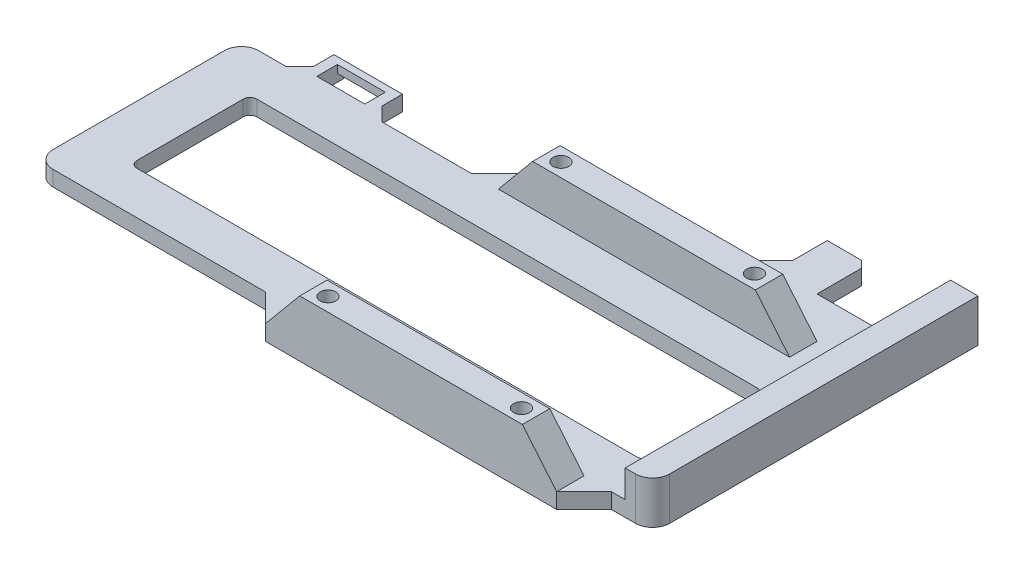
from build123d import *
from OCP.BRepFilletAPI import BRepFilletAPI_MakeChamfer

# Parameters (mm, degrees)
SKETCH1_W                       = 180
SKETCH1_H                       = 60
SKETCH1_W_2                     = 150
SKETCH1_H_2                     = 35
BOSS_EXTRUDE1_DEPTH             = 4.5
FILLET1_R                       = 5
FILLET2_R                       = 2
BOSS_EXTRUDE2_DEPTH             = 4.5
CHAMFER1_SIZE                   = 25
CHAMFER2_SIZE                   = 2
BOSS_EXTRUDE3_DEPTH             = 12
BOSS_EXTRUDE3_DIRECTION_2_REACH = 205.581
CHAMFER3_SIZE                   = 10
CHAMFER3_SIZE_2                 = 12
CHAMFER4_SIZE                   = 8
BOSS_EXTRUDE4_START             = 8
BOSS_EXTRUDE4_DEPTH             = 8
SKETCH5_R                       = 2.3
CUT_EXTRUDE1_DEPTH              = 14
CHAMFER5_SIZE                   = 12
CHAMFER5_SIZE2                  = 10
SKETCH6_W                       = 20
SKETCH6_H                       = 10
SKETCH6_W_2                     = 14
SKETCH6_H_2                     = 6
BOSS_EXTRUDE5_DEPTH             = 4.5
CHAMFER6_SIZE                   = 4
SKETCH7_W                       = 14
SKETCH7_H                       = 2.25
CUT_EXTRUDE2_DEPTH              = 3


with BuildPart() as part:
    # Sketch1 → Boss-Extrude1 (new body)
    with BuildSketch(Plane(origin=(0, 0, 0), x_dir=(1, 0, 0), z_dir=(0, 1, 0))):
        with Locations((90, 30)):
            Rectangle(SKETCH1_W, SKETCH1_H)
        with Locations((90, 30)):
            Rectangle(SKETCH1_W_2, SKETCH1_H_2, mode=Mode.SUBTRACT)
    extrude(amount=BOSS_EXTRUDE1_DEPTH)

    # Fillet1
    fillet1_edges = [part.edges().sort_by_distance(p)[0] for p in [
        (0, 2.25, -60),
        (180, 2.25, 0),
        (0, 2.25, 0),
    ]]
    fillet(fillet1_edges, radius=FILLET1_R)

    # Fillet2
    fillet2_edges = [part.edges().sort_by_distance(p)[0] for p in [
        (165, 2.25, -12.5),
        (165, 2.25, -47.5),
        (15, 2.25, -47.5),
        (15, 2.25, -12.5),
    ]]
    fillet(fillet2_edges, radius=FILLET2_R)

    # Sketch2 → Boss-Extrude2 (add)
    with BuildSketch(Plane(origin=(0, 4.5, 0), x_dir=(1, 0, 0), z_dir=(0, 1, 0))):
        Polygon((180, 80), (180, 60), (136, 60), (136, 80), (136, 95), (148, 95), (148, 80), (168, 80), (168, 95), (180, 95), align=None)
    extrude(amount=-BOSS_EXTRUDE2_DEPTH)

    # Chamfer1
    chamfer1_edges = [part.edges().sort_by_distance(p)[0] for p in [
        (136, 2.25, -60),
    ]]
    chamfer(chamfer1_edges, length=CHAMFER1_SIZE)

    # Chamfer2
    chamfer2_edges = [part.edges().sort_by_distance(p)[0] for p in [
        (168, 2.25, -95),
        (148, 2.25, -95),
    ]]
    chamfer(chamfer2_edges, length=CHAMFER2_SIZE)

    # Sketch3 → Boss-Extrude3 (add)
    with BuildSketch(Plane(origin=(0, 4.5, 0), x_dir=(1, 0, 0), z_dir=(0, 1, 0))):
        Polygon((90, -8), (160, -8), (160, 0), (90, 0), (75, 0), (75, -8), align=None)
        Polygon((160, 60), (90, 60), (75, 60), (75, 68), (90, 68), (160, 68), align=None)
    extrude(amount=BOSS_EXTRUDE3_DEPTH)

    # Boss-Extrude3 direction 2: up to this face of the body (flat: up to its plane)
    boss_extrude3_direction_2_end = Plane(part.part.faces().sort_by_distance((141, 0, -92.964686756))[0])
    # Sketch3 → Boss-Extrude3 direction 2 (add, up to the picked face)
    with BuildSketch(Plane(origin=(0, 4.5, 0), x_dir=(1, 0, 0), z_dir=(0, 1, 0)), mode=Mode.PRIVATE) as boss_extrude3_direction_2_sk1:
        Polygon((90, -8), (160, -8), (160, 0), (90, 0), (75, 0), (75, -8), align=None)
    boss_extrude3_direction_2_tool1 = split(extrude(boss_extrude3_direction_2_sk1.sketch, amount=-BOSS_EXTRUDE3_DIRECTION_2_REACH, mode=Mode.PRIVATE), bisect_by=boss_extrude3_direction_2_end, keep=Keep.BOTH, mode=Mode.PRIVATE)
    # Sketch3 → Boss-Extrude3 direction 2 (add, up to the picked face)
    with BuildSketch(Plane(origin=(0, 4.5, 0), x_dir=(1, 0, 0), z_dir=(0, 1, 0)), mode=Mode.PRIVATE) as boss_extrude3_direction_2_sk2:
        Polygon((160, 60), (90, 60), (75, 60), (75, 68), (90, 68), (160, 68), align=None)
    boss_extrude3_direction_2_tool2 = split(extrude(boss_extrude3_direction_2_sk2.sketch, amount=-BOSS_EXTRUDE3_DIRECTION_2_REACH, mode=Mode.PRIVATE), bisect_by=boss_extrude3_direction_2_end, keep=Keep.BOTH, mode=Mode.PRIVATE)
    add(boss_extrude3_direction_2_tool1.solids().sort_by(Axis((117.5, 4.5, 4), (0, -1, 0)))[0])
    add(boss_extrude3_direction_2_tool2.solids().sort_by(Axis((117.5, 4.5, -64), (0, -1, 0)))[0])

    # Chamfer3
    chamfer3_edges_1 = [part.edges().sort_by_distance(p)[0] for p in [
        (160, 16.5, -64),
    ]]
    chamfer3_side_1 = [part.faces().sort_by_distance(p)[0] for p in [
        (159.8, 16.5, -64),
    ]]
    chamfer3_edges_2 = [part.edges().sort_by_distance(p)[0] for p in [
        (75, 16.5, -64),
    ]]
    chamfer3_side_2 = [part.faces().sort_by_distance(p)[0] for p in [
        (75.2, 16.5, -64),
    ]]
    chamfer3_edges_3 = [part.edges().sort_by_distance(p)[0] for p in [
        (75, 16.5, 4),
    ]]
    chamfer3_side_3 = [part.faces().sort_by_distance(p)[0] for p in [
        (75.2, 16.5, 4),
    ]]
    chamfer3 = BRepFilletAPI_MakeChamfer(part.part.solid().wrapped)
    for e in chamfer3_edges_1:
        chamfer3.Add(CHAMFER3_SIZE - 0.0001, CHAMFER3_SIZE_2 - 0.0001, e.wrapped, chamfer3_side_1[0].wrapped)
    for e in chamfer3_edges_2:
        chamfer3.Add(CHAMFER3_SIZE - 0.0001, CHAMFER3_SIZE_2 - 0.0001, e.wrapped, chamfer3_side_2[0].wrapped)
    for e in chamfer3_edges_3:
        chamfer3.Add(CHAMFER3_SIZE - 0.0001, CHAMFER3_SIZE_2 - 0.0001, e.wrapped, chamfer3_side_3[0].wrapped)
    add(Compound.cast(chamfer3.Shape()), mode=Mode.REPLACE)  # a hair under: the kernel refuses the full size

    # Chamfer4
    chamfer4_edges = [part.edges().sort_by_distance(p)[0] for p in [
        (160, 2.25, 0),
        (75, 2.25, 0),
        (75, 2.25, -60),
    ]]
    chamfer(chamfer4_edges, length=CHAMFER4_SIZE - 0.0001)  # a hair under: the kernel refuses the full size

    # Sketch4 → Boss-Extrude4 (add)
    with BuildSketch(Plane(origin=(0, 4.5, 0), x_dir=(1, 0, 0), z_dir=(0, 1, 0)).offset(BOSS_EXTRUDE4_START)):
        with BuildLine():
            Line((180, 95), (180, 5))
            ThreePointArc((180, 5), (178.535533906, 1.464466094), (175, 0))
            Line((175, 0), (172, 0))
            Line((172, 0), (172, 95))
            Line((172, 95), (180, 95))
        make_face()
    extrude(amount=-BOSS_EXTRUDE4_DEPTH)

    # Sketch5 → Cut-Extrude1 (cut)
    with BuildSketch(Plane(origin=(0, 16.5, 0), x_dir=(1, 0, 0), z_dir=(0, 1, 0))):
        with Locations(Location((89.25, 64, 0), (0, 0, 270))):
            Circle(SKETCH5_R)
        with Locations(Location((145.75, 64, 0), (0, 0, 270))):
            Circle(SKETCH5_R)
        with Locations(Location((145.75, -4, 0), (0, 0, 270))):
            Circle(SKETCH5_R)
        with Locations(Location((89.25, -4, 0), (0, 0, 270))):
            Circle(SKETCH5_R)
    extrude(amount=-CUT_EXTRUDE1_DEPTH, mode=Mode.SUBTRACT)

    # Chamfer5
    chamfer5_edges = [part.edges().sort_by_distance(p)[0] for p in [
        (160, 16.5, 4),
    ]]
    chamfer5_side = [part.faces().sort_by_distance(p)[0] for p in [
        (160, 10.499961328, 4.00001875),
    ]]
    chamfer(chamfer5_edges, length=CHAMFER5_SIZE, length2=CHAMFER5_SIZE2, reference=chamfer5_side[0])

    # Sketch6 → Boss-Extrude5 (add)
    # profile 1 of 2: a face of its own
    with BuildSketch(Plane(origin=(0, 4.5, 0), x_dir=(1, 0, 0), z_dir=(0, 1, 0))):
        with Locations((27, 65)):
            Rectangle(SKETCH6_W, SKETCH6_H)
        with Locations((27, 65)):
            Rectangle(SKETCH6_W_2, SKETCH6_H_2, mode=Mode.SUBTRACT)
    # profile 2 of 2: a face of its own
    with BuildSketch(Plane(origin=(0, 4.5, 0), x_dir=(1, 0, 0), z_dir=(0, 1, 0))):
        with BuildLine():
            Line((168, 0), (172, 0))
            Line((172, 0), (172, 95))
            Line((172, 95), (170, 95))
            Line((170, 95), (168, 93))
            Line((168, 93), (168, 80))
            Line((168, 80), (148, 80))
            Line((148, 80), (148, 93))
            Line((148, 93), (146, 95))
            Line((146, 95), (136, 95))
            Line((136, 95), (136, 85))
            Line((136, 85), (119, 68))
            Line((119, 68), (160, 68))
            Line((160, 68), (160, 60))
            Line((160, 60), (75, 60))
            Line((75, 60), (75, 68))
            Line((75, 68), (67, 60))
            Line((67, 60), (5, 60))
            ThreePointArc((5, 60), (1.464466094, 58.535533906), (0, 55))
            Line((0, 55), (0, 5))
            ThreePointArc((0, 5), (1.464466094, 1.464466094), (5, 0))
            Line((5, 0), (67, 0))
            Line((67, 0), (75, -8))
            Line((75, -8), (75, 0))
            Line((75, 0), (160, 0))
            Line((160, 0), (160, -8))
            Line((160, -8), (168, 0))
        make_face()
        with BuildLine():
            ThreePointArc((163, 47.5), (164.414213562, 46.914213562), (165, 45.5))
            Line((165, 45.5), (165, 14.5))
            ThreePointArc((165, 14.5), (164.414213562, 13.085786438), (163, 12.5))
            Line((163, 12.5), (17, 12.5))
            ThreePointArc((17, 12.5), (15.585786438, 13.085786438), (15, 14.5))
            Line((15, 14.5), (15, 45.5))
            ThreePointArc((15, 45.5), (15.585786438, 46.914213562), (17, 47.5))
            Line((17, 47.5), (163, 47.5))
        make_face(mode=Mode.SUBTRACT)
    extrude(amount=-BOSS_EXTRUDE5_DEPTH)

    # Chamfer6
    chamfer6_edges = [part.edges().sort_by_distance(p)[0] for p in [
        (17, 2.25, -60),
        (37, 2.25, -60),
    ]]
    chamfer(chamfer6_edges, length=CHAMFER6_SIZE)

    # Sketch7 → Cut-Extrude2 (cut)
    with BuildSketch(Plane.XY.offset(-68)):
        with Locations((27, 1.125)):
            Rectangle(SKETCH7_W, SKETCH7_H)
    extrude(amount=-CUT_EXTRUDE2_DEPTH, mode=Mode.SUBTRACT)


solid = part.part
